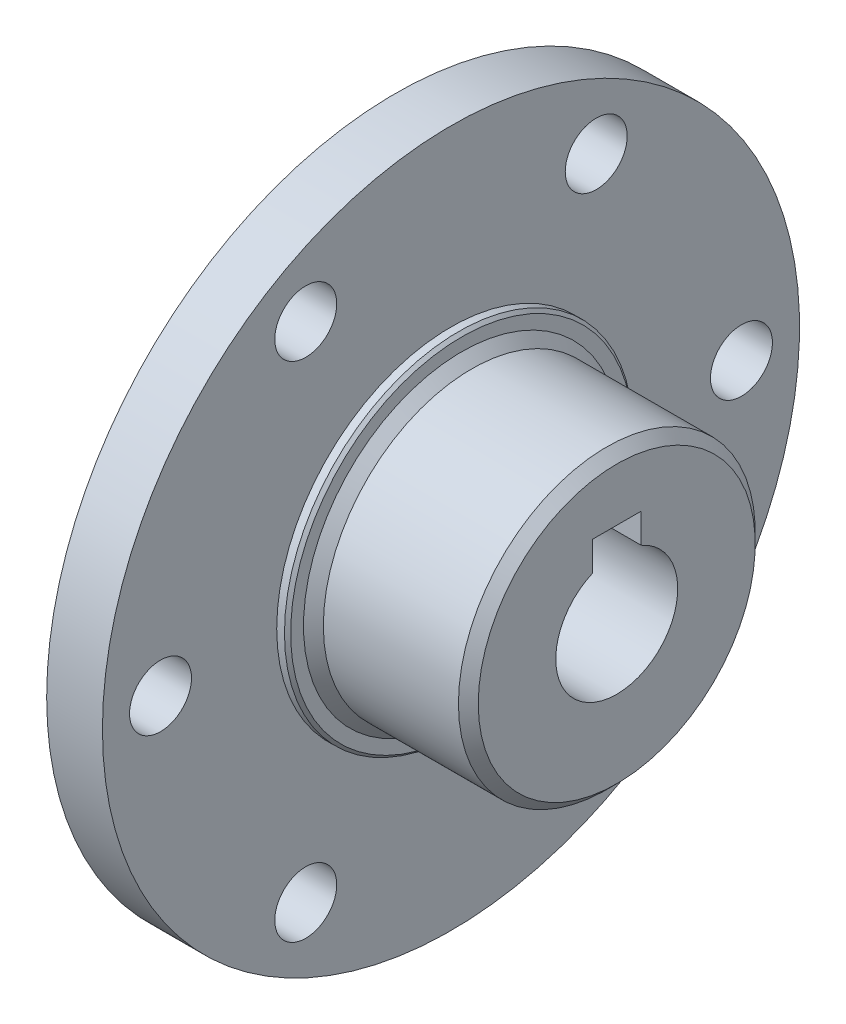
from build123d import *

# Parameters (mm, degrees)
SKETCH1_W                  = 4.572
SKETCH1_H                  = 28.575
SKETCH2_R                  = 14.2875
BOSS_EXTRUDE1_DEPTH        = 0.889
SKETCH3_R                  = 12.1666
BOSS_EXTRUDE2_DEPTH        = 12.7
BOSS_EXTRUDE3_START        = 0.889
SKETCH4_R                  = 14.2875
BOSS_EXTRUDE3_DEPTH        = 0.889
CUT_EXTRUDE1_DEPTH         = 45.676210112
SKETCH6_W                  = 19.05
SKETCH6_H                  = 5
F_10_CLEARANCE_HOLE1_D     = 5.08
F_10_CLEARANCE_HOLE1_DEPTH = 18.161
CHAMFER1_SIZE              = 0.254
CHAMFER2_SIZE              = 0.8128


with BuildPart() as part:
    # Sketch1 → Revolve1 (revolve)
    with BuildSketch(Plane(origin=(0, 0, 0), x_dir=(-1, 0, 0), z_dir=(0, 0, -1))):
        with Locations((15.321066246, 14.2875)):
            Rectangle(SKETCH1_W, SKETCH1_H)
    revolve(axis=Axis((-13.035066246, 0, 0), (-1, 0, 0)))

    # Sketch2 → Boss-Extrude1 (add)
    with BuildSketch(Plane(origin=(-13.035066246, 0, 0), x_dir=(0, 0, -1), z_dir=(1, 0, 0))):
        Circle(SKETCH2_R)
    extrude(amount=BOSS_EXTRUDE1_DEPTH)

    # Sketch3 → Boss-Extrude2 (add)
    with BuildSketch(Plane(origin=(-12.146066246, 0, 0), x_dir=(0, 0, -1), z_dir=(1, 0, 0))):
        Circle(SKETCH3_R)
    extrude(amount=BOSS_EXTRUDE2_DEPTH)

    # Sketch4 → Boss-Extrude3 (add)
    with BuildSketch(Plane.ZY.offset(17.607066246).offset(BOSS_EXTRUDE3_START)):
        Circle(SKETCH4_R)
    extrude(amount=-BOSS_EXTRUDE3_DEPTH)

    # Sketch5 → Cut-Extrude1 (cut, through all)
    with BuildSketch(Plane.ZY.offset(18.496066246)):
        with BuildLine():
            Line((2, 4.582575695), (2, 7))
            Line((2, 7), (-2, 7))
            Line((-2, 7), (-2, 4.582575695))
            ThreePointArc((-2, 4.582575695), (0, 5), (2, 4.582575695))
        make_face()
    extrude(amount=-CUT_EXTRUDE1_DEPTH, mode=Mode.SUBTRACT)

    # Sketch6 → Cut-Revolve1 (revolve, cut)
    with BuildSketch(Plane(origin=(0, 0, 0), x_dir=(-1, 0, 0), z_dir=(0, 0, -1))):
        with Locations((8.971066246, 2.5)):
            Rectangle(SKETCH6_W, SKETCH6_H)
    revolve(axis=Axis((0.553933754, 0, 0), (-1, 0, 0)), mode=Mode.SUBTRACT)

    # #10 Clearance Hole1
    with Locations(Plane.ZY.offset(17.607066246)):
        with Locations((11.90625, 20.622229928), (-11.90625, 20.622229928), (-23.8125, 0), (-11.90625, -20.622229928), (11.90625, -20.622229928), (23.8125, 0)):
            Hole(F_10_CLEARANCE_HOLE1_D / 2, depth=F_10_CLEARANCE_HOLE1_DEPTH)

    # Chamfer1
    chamfer1_edges = [part.edges().sort_by_distance(p)[0] for p in [
        (-12.146066246, 0, 14.2875),
        (-18.496066246, 0, -14.2875),
    ]]
    chamfer(chamfer1_edges, length=CHAMFER1_SIZE)

    # Chamfer2
    chamfer2_edges = [part.edges().sort_by_distance(p)[0] for p in [
        (-12.146066246, 0, 12.1666),
        (0.553933754, 0, 12.1666),
    ]]
    chamfer(chamfer2_edges, length=CHAMFER2_SIZE)


solid = part.part
